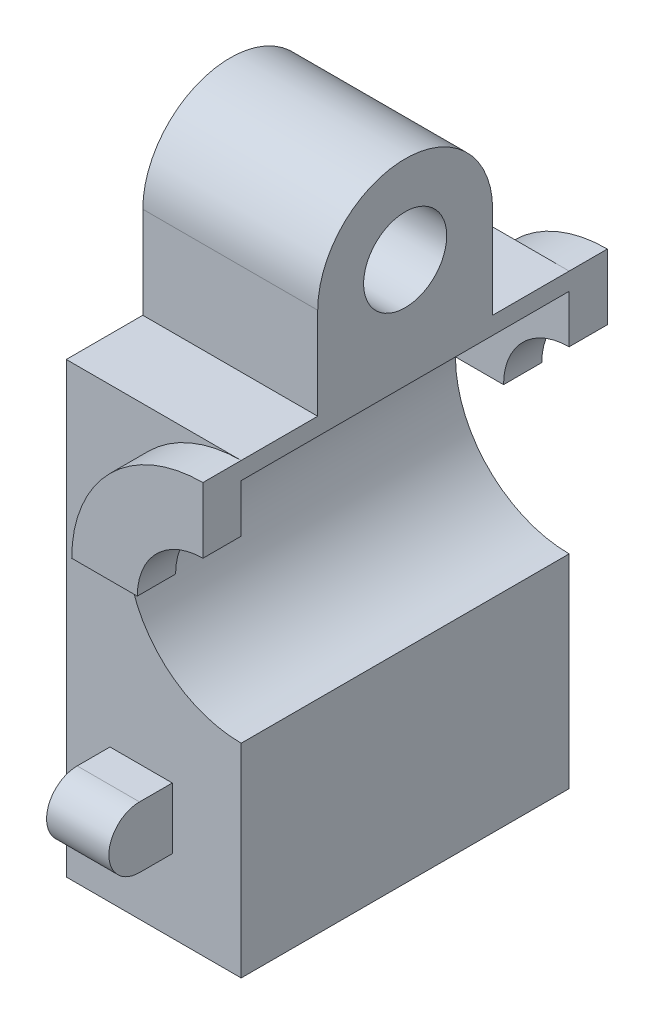
from build123d import *

# Parameters (mm, degrees)
BOSS_EXTRUDE1_DEPTH       = 15
BOSS_EXTRUDE2_DEPTH       = 2.85
SKETCH4_W                 = 1.05
SKETCH4_H                 = 0.3
REVOLVE1_ANGLE            = 180
SKETCH5_R                 = 1.9
BOSS_EXTRUDE3_DEPTH       = 6
BOSS_EXTRUDE4_REACH       = 29.869
BOSS_EXTRUDE4_END_RADIUS  = 6
SKETCH6_W                 = 6
SKETCH6_H                 = 8
SKETCH8_W                 = 1.75
SKETCH8_H                 = 3
REVOLVE2_ANGLE            = 90
BOSS_EXTRUDE5_DEPTH       = 15
BOSS_EXTRUDE5_START       = -8
BOSS_EXTRUDE5_2_OUTLINE_R = 1.9
BOSS_EXTRUDE5_2_DEPTH     = 2


with BuildPart() as part:
    # Sketch1 → Boss-Extrude1 (new body)
    with BuildSketch(Plane.XY):
        with BuildLine():
            Line((0, -5), (0, -14.5))
            Line((0, -14.5), (-6, -14.5))
            Line((-6, -14.5), (-6, 0))
            ThreePointArc((-6, 0), (-4.242640687, 4.242640687), (0, 6))
            Line((0, 6), (0, 5))
            ThreePointArc((0, 5), (-5, 0), (0, -5))
        make_face()
    extrude(amount=BOSS_EXTRUDE1_DEPTH)

    # Sketch3 → Boss-Extrude2 (add)
    with BuildSketch(Plane(origin=(-6, 0, 0), x_dir=(0, 0, -1), z_dir=(1, 0, 0))):
        with BuildLine():
            Line((1.5, -8.35), (0, -8.35))
            Line((0, -8.35), (0, -11.15))
            Line((0, -11.15), (1.5, -11.15))
            ThreePointArc((1.5, -11.15), (2.9, -9.75), (1.5, -8.35))
        make_face()
        with BuildLine():
            Line((-16.5, -11.15), (-15, -11.15))
            Line((-15, -11.15), (-15, -8.35))
            Line((-15, -8.35), (-16.5, -8.35))
            ThreePointArc((-16.5, -8.35), (-17.9, -9.75), (-16.5, -11.15))
        make_face()
    extrude(amount=BOSS_EXTRUDE2_DEPTH)

    # Sketch4 → Revolve1 (revolve)
    with BuildSketch(Plane(origin=(0, 0, 0), x_dir=(0, 0, -1), z_dir=(1, 0, 0))):
        with Locations((-11.575, 4.85)):
            Rectangle(SKETCH4_W, SKETCH4_H)
        with Locations((-3.425, 4.85)):
            Rectangle(SKETCH4_W, SKETCH4_H)
    revolve(axis=Axis((0, 0, 15), (0, 0, 1)), revolution_arc=REVOLVE1_ANGLE)



with BuildPart() as body_2:
    # Sketch5 → Boss-Extrude3 (new body)
    with BuildSketch(Plane(origin=(0, 0, 0), x_dir=(0, 0, -1), z_dir=(1, 0, 0))):
        with BuildLine():
            Line((-11.5, 6), (-11.5, 10.2))
            ThreePointArc((-11.5, 10.2), (-7.5, 14.2), (-3.5, 10.2))
            Line((-3.5, 10.2), (-3.5, 6))
            Line((-3.5, 6), (-11.5, 6))
        make_face()
        with Locations((-7.5, 10.2)):
            Circle(SKETCH5_R, mode=Mode.SUBTRACT)
    extrude(amount=-BOSS_EXTRUDE3_DEPTH)


with BuildPart() as part_1:
    add(part.part)

    add(body_2.part)  # Boss-Extrude4 merges body 2
    # Boss-Extrude4: up to this cylinder (the profile starts outside it)
    boss_extrude4_end = Plane(origin=(0, 0, 7.5), z_dir=(0, 0, -1)) * Cylinder(BOSS_EXTRUDE4_END_RADIUS, 72.738, mode=Mode.PRIVATE)
    # Sketch6 → Boss-Extrude4 (add, up to the surface)
    with BuildSketch(Plane.XZ.offset(-6), mode=Mode.PRIVATE) as boss_extrude4_sk1:
        with Locations((-3, 7.5)):
            Rectangle(SKETCH6_W, SKETCH6_H)
    boss_extrude4_tool1 = extrude(boss_extrude4_sk1.sketch, amount=BOSS_EXTRUDE4_REACH, mode=Mode.PRIVATE) - boss_extrude4_end
    add(boss_extrude4_tool1.solids().sort_by_distance((-3, 6, 7.5))[0])

    # Sketch7 → Cut-Revolve1 (revolve, cut)
    with BuildSketch(Plane(origin=(0, 0, 0), x_dir=(0, 0, -1), z_dir=(1, 0, 0))):
        Polygon((-15, 5.2), (-15, 5), (-12.1, 5), (-12.1, 4.7), (-11.05, 4.7), (-11.05, 5), (-3.95, 5), (-3.95, 4.7), (-2.9, 4.7), (-2.9, 5), (0, 5), (0, 5.2), align=None)
    revolve(axis=Axis((0, 0, 15), (0, 0, -1)), mode=Mode.SUBTRACT)

    # Sketch8 → Revolve2 (revolve)
    with BuildSketch(Plane(origin=(0, 0, 0), x_dir=(0, 0, -1), z_dir=(1, 0, 0))):
        with Locations((-15.875, 4.5)):
            Rectangle(SKETCH8_W, SKETCH8_H)
        with Locations((0.875, 4.5)):
            Rectangle(SKETCH8_W, SKETCH8_H)
    revolve(axis=Axis((0, 0, 15), (0, 0, 1)), revolution_arc=REVOLVE2_ANGLE)

    # Boss-Extrude5: read off the stored shape, not the designer's step
    # Boss-Extrude5 outline → Boss-Extrude5 (add)
    with BuildSketch(Plane.XY):
        with BuildLine():
            Line((-8, -14.5), (-6, -14.5))
            Line((-6, -14.5), (-6, 0))
            ThreePointArc((-6, 0), (-4.242640687, 4.242640687), (0, 6))
            Line((0, 6), (-8, 6))
            Line((-8, 6), (-8, -14.5))
        make_face()
    extrude(amount=BOSS_EXTRUDE5_DEPTH)

    # Boss-Extrude5 2 outline → Boss-Extrude5 2 (add)
    with BuildSketch(Plane.YZ.offset(BOSS_EXTRUDE5_START)):
        with BuildLine():
            Line((10.2, 11.5), (6, 11.5))
            Line((6, 11.5), (6, 3.5))
            Line((6, 3.5), (10.2, 3.5))
            ThreePointArc((10.2, 3.5), (14.2, 7.5), (10.2, 11.5))
        make_face()
        with Locations((10.2, 7.5)):
            Circle(BOSS_EXTRUDE5_2_OUTLINE_R, mode=Mode.SUBTRACT)
    extrude(amount=BOSS_EXTRUDE5_2_DEPTH)


solid = part_1.part
